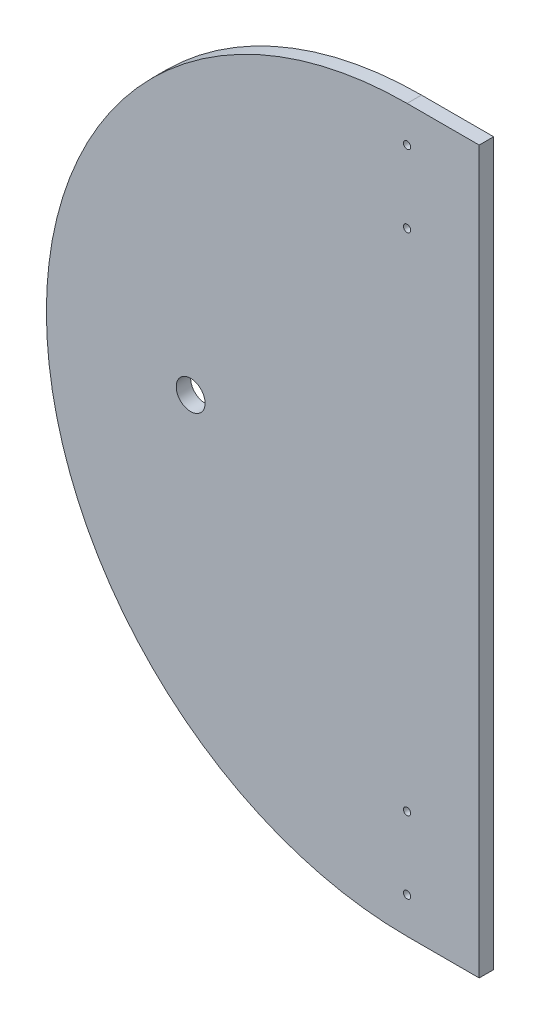
from build123d import *

# Parameters (mm, degrees)
SKETCH_1_R      = 1.25
SKETCH_1_R_2    = 5
EXTRUDE_1_DEPTH = 5


with BuildPart() as part:
    # 草图1 → 凸台-拉伸1 (new body)
    with BuildSketch(Plane.XY):
        with BuildLine():
            Line((0, 125), (25, 125))
            Line((25, 125), (25, -125))
            Line((25, -125), (0, -125))
            ThreePointArc((0, -125), (-125, 0), (0, 125))
        make_face()
        with Locations((0, 112.5)):
            Circle(SKETCH_1_R, mode=Mode.SUBTRACT)
        with Locations((0, 87.5)):
            Circle(SKETCH_1_R, mode=Mode.SUBTRACT)
        with Locations((0, -87.5)):
            Circle(SKETCH_1_R, mode=Mode.SUBTRACT)
        with Locations((0, -112.5)):
            Circle(SKETCH_1_R, mode=Mode.SUBTRACT)
        with Locations((-75, 0)):
            Circle(SKETCH_1_R_2, mode=Mode.SUBTRACT)
    extrude(amount=EXTRUDE_1_DEPTH)


solid = part.part
